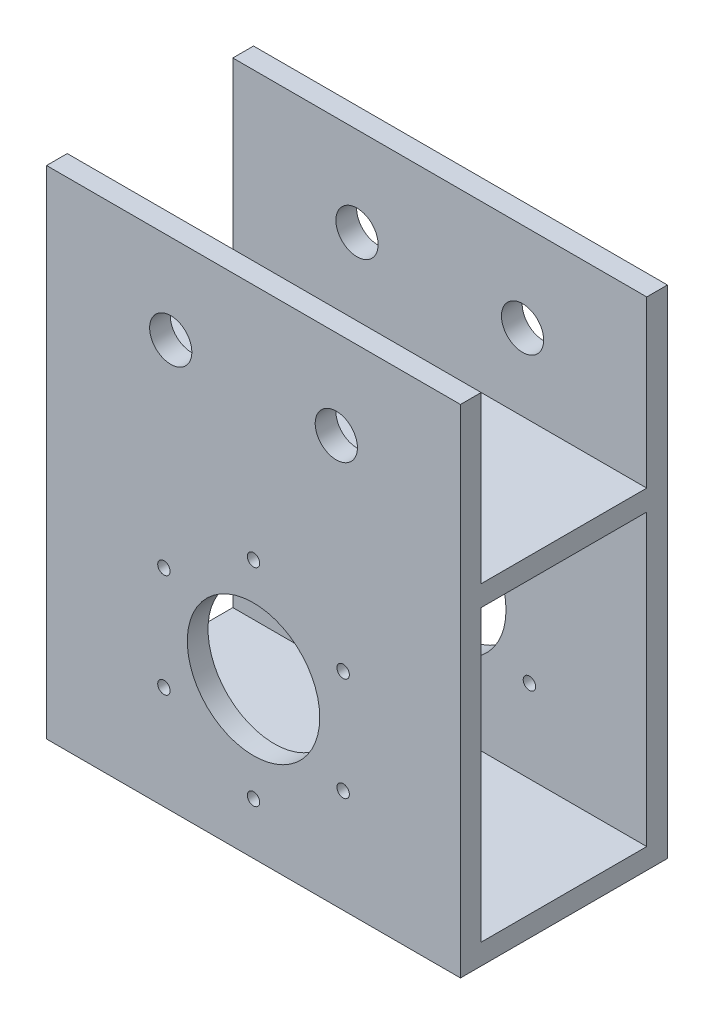
from build123d import *

# Parameters (mm, degrees)
SKETCH1_W                = 100
SKETCH1_H                = 120
BOSS_EXTRUDE1_DEPTH      = 5
SKETCH2_W                = 100
SKETCH2_H                = 5
BOSS_EXTRUDE2_DEPTH      = 45
BOSS_EXTRUDE3_DEPTH      = 40
BOSS_EXTRUDE3_DEPTH_BACK = 60
SKETCH3_W                = 100
SKETCH3_H                = 5
SKETCH6_W                = 100
SKETCH6_H                = 5
BOSS_EXTRUDE4_DEPTH      = 15
SKETCH7_W                = 100
SKETCH7_H                = 5
BOSS_EXTRUDE5_DEPTH      = 45
SKETCH8_R                = 16
SKETCH8_R_2              = 1.5
CUT_EXTRUDE1_DEPTH       = 93.736184955
SKETCH10_R               = 5.1
CUT_EXTRUDE2_DEPTH       = 93.736184955


with BuildPart() as part:
    # Sketch1 → Boss-Extrude1 (new body)
    with BuildSketch(Plane.XY):
        Rectangle(SKETCH1_W, SKETCH1_H)
    extrude(amount=BOSS_EXTRUDE1_DEPTH)

    # Sketch2 → Boss-Extrude2 (add)
    with BuildSketch(Plane.XY.offset(5)):
        with Locations((0, 17.5)):
            Rectangle(SKETCH2_W, SKETCH2_H)
    extrude(amount=BOSS_EXTRUDE2_DEPTH)

    # Sketch3 → Boss-Extrude3 (add, two sides: drawn at the far end of the back side and taken through both)
    with BuildSketch(Plane(origin=(0, 20, 0), x_dir=(1, 0, 0), z_dir=(0, 1, 0)).offset(-BOSS_EXTRUDE3_DEPTH_BACK)):
        with Locations((0, -47.5)):
            Rectangle(SKETCH3_W, SKETCH3_H)
    extrude(amount=BOSS_EXTRUDE3_DEPTH + BOSS_EXTRUDE3_DEPTH_BACK)

    # Sketch6 → Boss-Extrude4 (add)
    with BuildSketch(Plane.XZ.offset(40)):
        with Locations((0, 47.5)):
            Rectangle(SKETCH6_W, SKETCH6_H)
        with Locations((0, 2.5)):
            Rectangle(SKETCH6_W, SKETCH6_H)
    extrude(amount=BOSS_EXTRUDE4_DEPTH)

    # Sketch7 → Boss-Extrude5 (add)
    with BuildSketch(Plane.XY.offset(5)):
        with Locations((0, -57.5)):
            Rectangle(SKETCH7_W, SKETCH7_H)
    extrude(amount=BOSS_EXTRUDE5_DEPTH)

    # Sketch8 → Cut-Extrude1 (cut, through all)
    with BuildSketch(Plane.XY.offset(50)):
        with Locations((0, -22.5)):
            Circle(SKETCH8_R)
        with Locations((0, 2.5)):
            Circle(SKETCH8_R_2)
        with Locations((21.650635095, -10)):
            Circle(SKETCH8_R_2)
        with Locations((21.650635095, -35)):
            Circle(SKETCH8_R_2)
        with Locations((0, -47.5)):
            Circle(SKETCH8_R_2)
        with Locations((-21.650635095, -35)):
            Circle(SKETCH8_R_2)
        with Locations((-21.650635095, -10)):
            Circle(SKETCH8_R_2)
    extrude(amount=-CUT_EXTRUDE1_DEPTH, mode=Mode.SUBTRACT)

    # Sketch10 → Cut-Extrude2 (cut, through all)
    with BuildSketch(Plane.XY.offset(50)):
        with Locations((-20, 38.494629442)):
            Circle(SKETCH10_R)
        with Locations((20, 38.494629442)):
            Circle(SKETCH10_R)
    extrude(amount=-CUT_EXTRUDE2_DEPTH, mode=Mode.SUBTRACT)


solid = part.part
